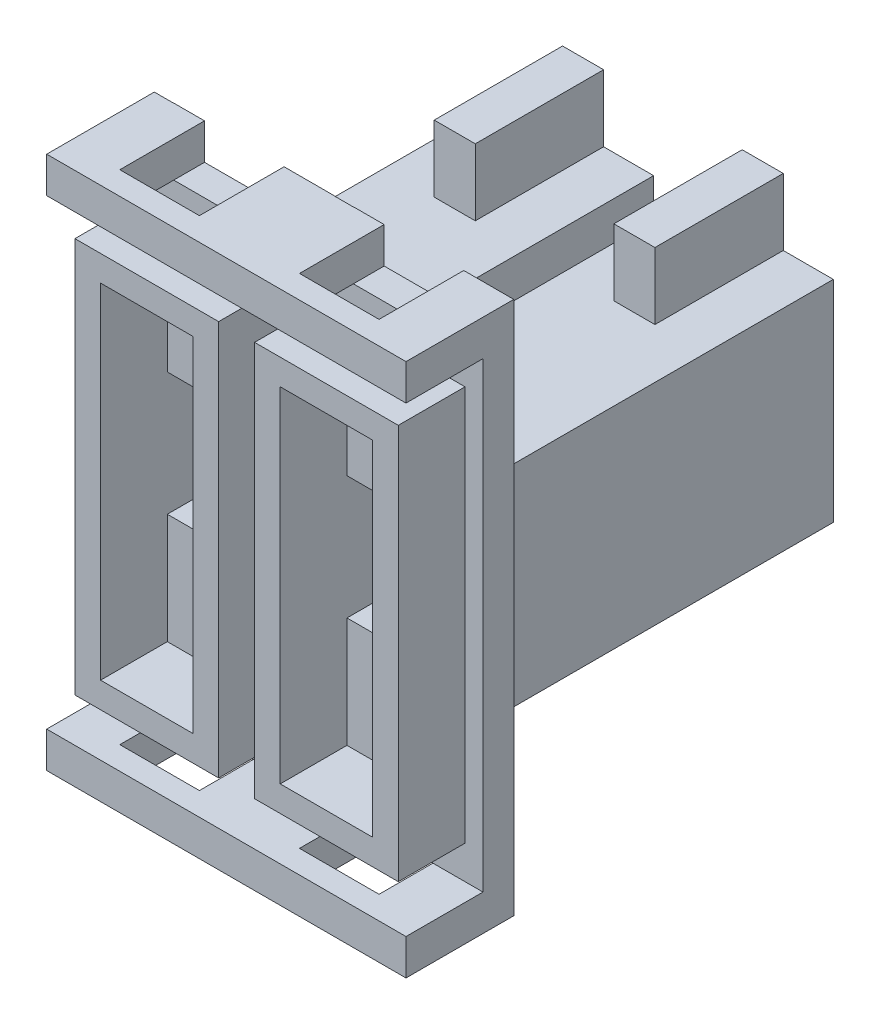
from build123d import *

# Parameters (mm, degrees)
SKETCH_1_W                     = 3.125
SKETCH_1_H                     = 10.4
EXTRUDE_1_DEPTH                = 2.1
CUT_EXTRUDE_1_REACH            = 8.249
SKETCH_2_W                     = 6.25
SKETCH_2_H                     = 9
SKETCH_3_W                     = 1.55
SKETCH_3_H                     = 0.7
CUT_EXTRUDE_2_DEPTH            = 1.05
SKETCH_5_W                     = 1.55
SKETCH_5_H                     = 0.7
CUT_EXTRUDE_4_DEPTH            = 1.05
EXTRUDE_3_DEPTH                = 6.6
SKETCH_9_W                     = 2.8
SKETCH_9_H                     = 7.7
EXTRUDE_4_DEPTH                = 1.3
CUT_EXTRUDE_6_REACH            = 11.424
SKETCH_11_W                    = 1.8
SKETCH_11_H                    = 6.7
CUT_EXTRUDE_9_REACH            = 11.047
SKETCH_14_W                    = 1.8
SKETCH_14_H                    = 2.4
CUT_EXTRUDE_11_REACH           = 14.749
SKETCH_16_W                    = 1.55
SKETCH_16_H                    = 0.6
CUT_EXTRUDE_12_REACH           = 14.749
SKETCH_17_W                    = 1.55
SKETCH_17_H                    = 0.6
EXTRUDE_6_DEPTH                = 0.375
SKETCH_21_W                    = 0.8
SKETCH_21_H                    = 2.5
EXTRUDE_8_DEPTH                = 1.3
HOLE_WIZARD_2_1_2_1_2_D        = 2.1
HOLE_WIZARD_2_1_2_1_2_DEPTH    = 1.2
HOLE_WIZARD_1_5_1_5_1_D        = 1.5
HOLE_WIZARD_1_5_1_5_1_DEPTH    = 2.000025
FILLET_1_R                     = 0.3
PATTERN_LINEAR_1_COUNT         = 2
PATTERN_LINEAR_1_PITCH         = 3.5
FILLET_1_OF_PATTERN_LINEAR_1_R = 0.3


with BuildPart() as part:
    # Эскиз1 → Бобышка-Вытянуть1 (new body)
    with BuildSketch(Plane.XY.offset(1.05)):
        with Locations((-1.5625, 0)):
            Rectangle(SKETCH_1_W, SKETCH_1_H)
    extrude_1 = extrude(amount=-EXTRUDE_1_DEPTH)

    # Эскиз2 → Вырез-Вытянуть1 (cut, up to next)
    with BuildSketch(Plane(origin=(0, 0, -0.45), x_dir=(-1, 0, 0), z_dir=(0, 0, -1)), mode=Mode.PRIVATE) as cut_extrude_1_sk1:
        Rectangle(SKETCH_2_W, SKETCH_2_H)
    cut_extrude_1_tool1 = extrude(cut_extrude_1_sk1.sketch, amount=-CUT_EXTRUDE_1_REACH, mode=Mode.PRIVATE) & part.part
    cut_extrude_1 = cut_extrude_1_tool1.solids().sort_by_distance((0, 0, -0.45))[0]
    add(cut_extrude_1, mode=Mode.SUBTRACT)

    # Эскиз3 → Вырез-Вытянуть2 (cut)
    with BuildSketch(Plane(origin=(0, 0, -0.45), x_dir=(-1, 0, 0), z_dir=(0, 0, -1))):
        with Locations((1.75, 4.85)):
            Rectangle(SKETCH_3_W, SKETCH_3_H)
    cut_extrude_2 = extrude(amount=-CUT_EXTRUDE_2_DEPTH, mode=Mode.SUBTRACT)

    # Эскиз5 → Вырез-Вытянуть4 (cut)
    with BuildSketch(Plane(origin=(0, 0, -0.45), x_dir=(-1, 0, 0), z_dir=(0, 0, -1))):
        with Locations((1.75, -4.85)):
            Rectangle(SKETCH_5_W, SKETCH_5_H)
    cut_extrude_4 = extrude(amount=-CUT_EXTRUDE_4_DEPTH, mode=Mode.SUBTRACT)

    # Эскиз8 → Бобышка-Вытянуть3 (add)
    with BuildSketch(Plane(origin=(0, 0, -7.65), x_dir=(-1, 0, 0), z_dir=(0, 0, -1))):
        with BuildLine():
            Line((3.125, 2.05), (0.375, 2.05))
            Line((0.375, 2.05), (0.375, -2.05))
            ThreePointArc((0.375, -2.05), (1.75, -1.502368755), (3.125, -2.05))
            Line((3.125, -2.05), (3.125, 2.05))
        make_face()
    extrude_3 = extrude(amount=-EXTRUDE_3_DEPTH)

    # Эскиз9 → Бобышка-Вытянуть4 (add)
    with BuildSketch(Plane.XY.offset(0.85)):
        with Locations((-1.75, 0)):
            Rectangle(SKETCH_9_W, SKETCH_9_H)
    extrude_4 = extrude(amount=-EXTRUDE_4_DEPTH)

    # Эскиз11 → Вырез-Вытянуть6 (cut, up to next)
    with BuildSketch(Plane(origin=(0, 0, -0.45), x_dir=(-1, 0, 0), z_dir=(0, 0, -1)), mode=Mode.PRIVATE) as cut_extrude_6_sk1:
        with Locations((1.75, 0)):
            Rectangle(SKETCH_11_W, SKETCH_11_H)
    cut_extrude_6_tool1 = extrude(cut_extrude_6_sk1.sketch, amount=-CUT_EXTRUDE_6_REACH, mode=Mode.PRIVATE) & part.part
    cut_extrude_6 = cut_extrude_6_tool1.solids().sort_by_distance((-1.75, 0, -0.45))[0]
    add(cut_extrude_6, mode=Mode.SUBTRACT)

    # Эскиз14 → Вырез-Вытянуть9 (cut, up to next)
    with BuildSketch(Plane(origin=(0, 0, -5.65), x_dir=(-1, 0, 0), z_dir=(0, 0, -1)), mode=Mode.PRIVATE) as cut_extrude_9_sk1:
        with Locations((1.75, 0)):
            Rectangle(SKETCH_14_W, SKETCH_14_H)
    cut_extrude_9_tool1 = extrude(cut_extrude_9_sk1.sketch, amount=-CUT_EXTRUDE_9_REACH, mode=Mode.PRIVATE) & part.part
    cut_extrude_9 = cut_extrude_9_tool1.solids().sort_by_distance((-1.75, 0, -5.65))[0]
    add(cut_extrude_9, mode=Mode.SUBTRACT)

    # Эскиз16 → Вырез-Вытянуть11 (cut, up to next)
    with BuildSketch(Plane(origin=(0, -4.5, 0), x_dir=(1, 0, 0), z_dir=(0, 1, 0)), mode=Mode.PRIVATE) as cut_extrude_11_sk1:
        with Locations((-1.75, 0.75)):
            Rectangle(SKETCH_16_W, SKETCH_16_H)
    cut_extrude_11_tool1 = extrude(cut_extrude_11_sk1.sketch, amount=-CUT_EXTRUDE_11_REACH, mode=Mode.PRIVATE) & part.part
    cut_extrude_11 = cut_extrude_11_tool1.solids().sort_by_distance((-1.75, -4.5, -0.75))[0]
    add(cut_extrude_11, mode=Mode.SUBTRACT)

    # Эскиз17 → Вырез-Вытянуть12 (cut, up to next)
    with BuildSketch(Plane.XZ.offset(-4.5), mode=Mode.PRIVATE) as cut_extrude_12_sk1:
        with Locations((-1.75, -0.75)):
            Rectangle(SKETCH_17_W, SKETCH_17_H)
    cut_extrude_12_tool1 = extrude(cut_extrude_12_sk1.sketch, amount=-CUT_EXTRUDE_12_REACH, mode=Mode.PRIVATE) & part.part
    cut_extrude_12 = cut_extrude_12_tool1.solids().sort_by_distance((-1.75, 4.5, -0.75))[0]
    add(cut_extrude_12, mode=Mode.SUBTRACT)

    # Эскиз19 → Бобышка-Вытянуть6 (add)
    with BuildSketch(Plane(origin=(-3.5, 0, 0), x_dir=(0, -1, 0), z_dir=(-1, 0, 0))):
        Polygon((1.65, -1.046361901), (5.2, -1.046361901), (5.2, 1.05), (4.5, 1.05), (4.5, -0.45), (-4.5, -0.45), (-4.5, 1.05), (-5.2, 1.05), (-5.2, -1.046361901), align=None)
    extrude_6 = extrude(amount=-EXTRUDE_6_DEPTH)

    # Эскиз21 → Бобышка-Вытянуть8 (add)
    with BuildSketch(Plane(origin=(0, 3.35, 0), x_dir=(1, 0, 0), z_dir=(0, 1, 0))):
        with Locations((-1.75, 6.4)):
            Rectangle(SKETCH_21_W, SKETCH_21_H)
    extrude_8 = extrude(amount=-EXTRUDE_8_DEPTH)

    # Диаметр отверстия Ø2.1 (2.1)2
    with Locations(Plane(origin=(0, 0, -7.65), x_dir=(-1, 0, 0), z_dir=(0, 0, -1))):
        with Locations((1.75, 0)):
            hole_wizard_2_1_2_1_2 = Hole(HOLE_WIZARD_2_1_2_1_2_D / 2, depth=HOLE_WIZARD_2_1_2_1_2_DEPTH)

    # Диаметр отверстия Ø1.5 (1.5)1
    with Locations(Plane.XY.offset(-5.65)):
        with Locations((-1.75, 0)):
            hole_wizard_1_5_1_5_1 = Hole(HOLE_WIZARD_1_5_1_5_1_D / 2, depth=HOLE_WIZARD_1_5_1_5_1_DEPTH)

    # Скругление1
    fillet_1_edges = [part.edges().sort_by_distance(p)[0] for p in [
        (-2.8, 0, -6.45),
    ]]
    fillet(fillet_1_edges, radius=FILLET_1_R - 0.0001)  # a hair under: the kernel refuses the full size

    # Линейный массив1: Бобышка-Вытянуть1, Вырез-Вытянуть1, Вырез-Вытянуть2, Вырез-Вытянуть4, Бобышка-Вытянуть3, Бобышка-Вытянуть4, Вырез-Вытянуть6, Вырез-Вытянуть9, Вырез-Вытянуть11, Вырез-Вытянуть12, Бобышка-Вытянуть6, Бобышка-Вытянуть8, Диаметр отверстия Ø2.1 (2.1)2, Диаметр отверстия Ø1.5 (1.5)1 ×2
    with Locations(*[(i * PATTERN_LINEAR_1_PITCH, 0, 0) for i in range(1, PATTERN_LINEAR_1_COUNT)]):
        add(extrude_1)
        add(cut_extrude_1, mode=Mode.SUBTRACT)
        add(cut_extrude_2, mode=Mode.SUBTRACT)
        add(cut_extrude_4, mode=Mode.SUBTRACT)
        add(extrude_3)
        add(extrude_4)
        add(cut_extrude_6, mode=Mode.SUBTRACT)
        add(cut_extrude_9, mode=Mode.SUBTRACT)
        add(cut_extrude_11, mode=Mode.SUBTRACT)
        add(cut_extrude_12, mode=Mode.SUBTRACT)
        add(extrude_6)
        add(extrude_8)
        add(hole_wizard_2_1_2_1_2, mode=Mode.SUBTRACT)
        add(hole_wizard_1_5_1_5_1, mode=Mode.SUBTRACT)

    # Скругление1 of Линейный массив1
    fillet_1_of_pattern_linear_1_edges = [part.edges().sort_by_distance(p)[0] for p in [
        (0.7, 0, -6.45),
    ]]
    fillet(fillet_1_of_pattern_linear_1_edges, radius=FILLET_1_OF_PATTERN_LINEAR_1_R - 0.0001)  # a hair under: the kernel refuses the full size


solid = part.part
